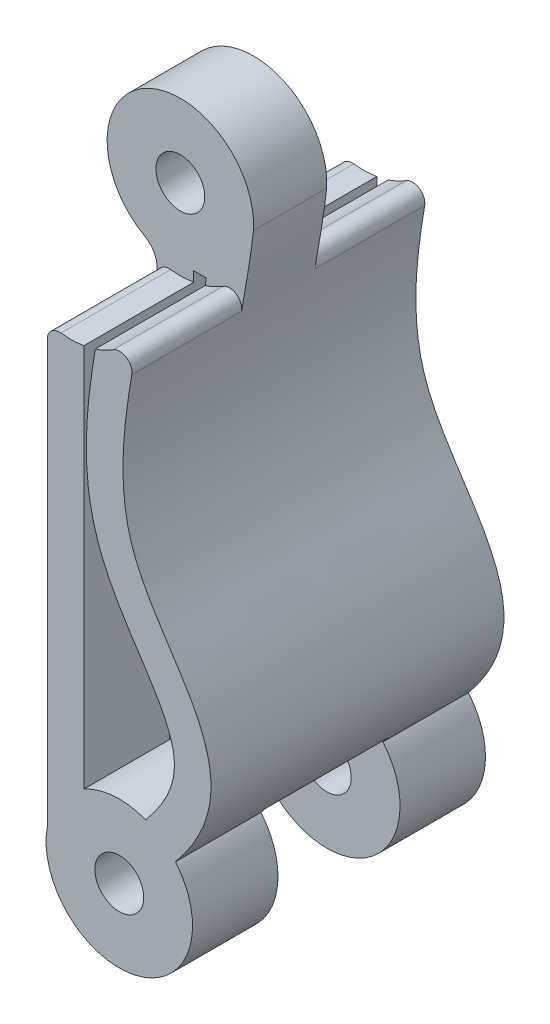
from build123d import *

# Parameters (mm, degrees)
SKETCH1_R               = 1
BOSS_EXTRUDE1_DEPTH     = 12
SKETCH2_R               = 3.3
CUT_EXTRUDE1_DEPTH      = 4.5
CUT_EXTRUDE2_DEPTH      = 2.5
CUT_EXTRUDE2_DEPTH_BACK = 2.5
SKETCH3_R               = 3.3
FILLET1_R               = 0.5
FILLET2_R               = 1


with BuildPart() as part:
    # Sketch1 → Boss-Extrude1 (new body)
    with BuildSketch(Plane.XY):
        with BuildLine():
            Line((-2.048815827, 41.884151299), (-2.048815827, 23.656682303))
            ThreePointArc((-2.048815827, 23.656682303), (1.66754925, 20.218418642), (3.205412143, 25.042110601))
            add(Edge.make_bspline(
                [(1.896008332, 44.529660516), (1.616069448, 41.758878479), (-0.936917255, 33.955197005), (6.844694938, 29.417505011), (3.205412143, 25.042110601)],
                knots=[0, 0, 0, 0, 0.461184527, 1, 1, 1, 1], degree=3))
            ThreePointArc((1.896008332, 44.529660516), (-2.768270934, 47.220856283), (-2.048815827, 41.884151299))
        make_face()
        with Locations((-1.097343641, 44.729270045)):
            Circle(SKETCH1_R, mode=Mode.SUBTRACT)
        with Locations((0.902656359, 23.119270045)):
            Circle(SKETCH1_R, mode=Mode.SUBTRACT)
        with BuildLine():
            Line((-0.031319306, 41.884151299), (-0.548815827, 41.884151299))
            Line((-0.548815827, 41.884151299), (-0.548815827, 25.744765902))
            ThreePointArc((-0.548815827, 25.744765902), (0.697826573, 26.112269337), (1.982912704, 25.918028026))
            add(Edge.make_bspline(
                [(-0.031319306, 41.884151299), (-0.050798368, 41.769911378), (-0.110231132, 41.41757497), (-0.243210983, 40.585051968), (-0.402027872, 39.353261852), (-0.479087992, 37.828213551), (-0.375856847, 36.275358456), (0.009969142, 34.681069755), (0.941317901, 32.770668216), (2.035404053, 31.246938586), (2.80471042, 29.909471533), (3.128629571, 29.030940173), (3.19641087, 28.267404516), (3.032335606, 27.550309668), (2.666289508, 26.829120101), (2.334869511, 26.350170873), (2.106769915, 26.067173099), (2.026097439, 25.969974031), (1.996829195, 25.934759382), (1.982912704, 25.918028026)],
                knots=[0.149200089, 0.149200089, 0.149200089, 0.149200089, 0.165683382, 0.19960026, 0.265533433, 0.331466606, 0.397399778, 0.463332951, 0.529266124, 0.661132469, 0.727065642, 0.792998815, 0.858931987, 0.92486516, 0.957831746, 0.990798333, 0.999039979, 1.001358499, 1.00341891, 1.00341891, 1.00341891, 1.00341891], degree=3))
        make_face(mode=Mode.SUBTRACT)
    extrude(amount=BOSS_EXTRUDE1_DEPTH)

    # Sketch2 → Cut-Extrude1 (cut)
    with BuildSketch(Plane.XY.offset(12)):
        with Locations((-1.097343641, 44.729270045)):
            Circle(SKETCH2_R)
    cut_extrude1 = extrude(amount=-CUT_EXTRUDE1_DEPTH, mode=Mode.SUBTRACT)

    # Mirror1: Cut-Extrude1 across plane
    add(cut_extrude1.mirror(Plane.XY.offset(6)), mode=Mode.SUBTRACT)

    # Sketch3 → Cut-Extrude2 (cut, two sides: drawn at the far end of the back side and taken through both)
    with BuildSketch(Plane.XY.offset(6).offset(-CUT_EXTRUDE2_DEPTH_BACK)):
        with Locations((0.902656359, 23.119270045)):
            Circle(SKETCH3_R)
    extrude(amount=CUT_EXTRUDE2_DEPTH + CUT_EXTRUDE2_DEPTH_BACK, mode=Mode.SUBTRACT)

    # Fillet1
    fillet1_edges = [part.edges().sort_by_distance(p)[0] for p in [
        (-2.048815827, 41.569412346, 2.25),
        (-2.048815827, 41.569412346, 9.75),
        (1.670824854, 42.932817101, 2.25),
        (1.670824854, 42.932817101, 9.75),
    ]]
    fillet(fillet1_edges, radius=FILLET1_R)

    # Fillet2
    fillet2_edges = [part.edges().sort_by_distance(p)[0] for p in [
        (-2.048815827, 41.884151299, 6),
    ]]
    fillet(fillet2_edges, radius=FILLET2_R)


solid = part.part
